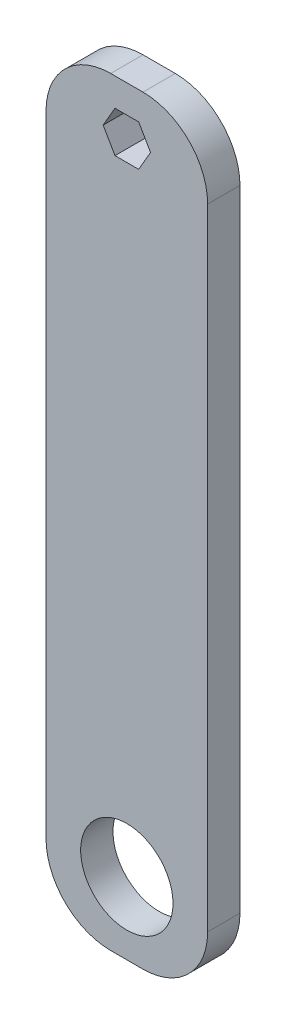
from build123d import *

# Parameters (mm, degrees)
SKETCH1_W           = 50
SKETCH1_H           = 10
BOSS_EXTRUDE1_DEPTH = 117.5
SKETCH2_R           = 14.2875
CUT_EXTRUDE1_DEPTH  = 127
FILLET1_R           = 20


with BuildPart() as part:
    # Sketch1 → Boss-Extrude1 (new, symmetric)
    with BuildSketch(Plane(origin=(0, 0, 0), x_dir=(1, 0, 0), z_dir=(0, 1, 0))):
        Rectangle(SKETCH1_W, SKETCH1_H)
    extrude(amount=BOSS_EXTRUDE1_DEPTH, both=True)

    # Sketch2 → Cut-Extrude1 (cut)
    with BuildSketch(Plane.XY.offset(5)):
        with Locations((0, -95.25)):
            Circle(SKETCH2_R)
        Polygon((3.666174209, 96.15), (7.332348419, 102.5), (3.666174209, 108.85), (-3.666174209, 108.85), (-7.332348419, 102.5), (-3.666174209, 96.15), align=None)
    extrude(amount=-CUT_EXTRUDE1_DEPTH, mode=Mode.SUBTRACT)

    # Fillet1
    fillet1_edges = [part.edges().sort_by_distance(p)[0] for p in [
        (-25, -117.5, 0),
        (25, -117.5, 0),
        (25, 117.5, 0),
        (-25, 117.5, 0),
    ]]
    fillet(fillet1_edges, radius=FILLET1_R)


solid = part.part
